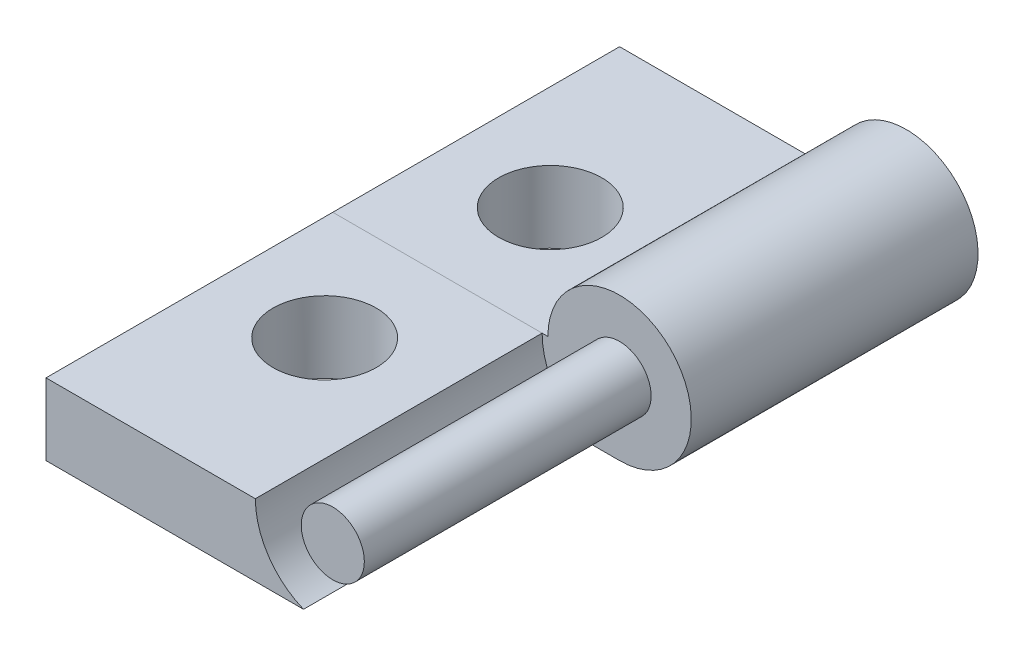
from build123d import *

# Parameters (mm, degrees)
BOSS_EXTRUDE1_DEPTH = 12.7
SKETCH3_R           = 1.397
BOSS_EXTRUDE2_DEPTH = 12.7
SKETCH4_R           = 2.286
CUT_EXTRUDE1_DEPTH  = 12.7


with BuildPart() as part:
    # Sketch1 → Boss-Extrude1 (new body)
    with BuildSketch(Plane.XY):
        with BuildLine():
            Line((0, 0), (12.7, 0))
            ThreePointArc((12.7, 0), (14.94506403, 5.42006403), (9.525, 3.175))
            Line((9.525, 3.175), (0, 3.175))
            Line((0, 3.175), (0, 0))
        make_face()
    extrude(amount=BOSS_EXTRUDE1_DEPTH)

    # Sketch3 → Boss-Extrude2 (add)
    with BuildSketch(Plane.XY.offset(12.7)):
        with BuildLine():
            ThreePointArc((11.404586257, 0), (9.853903302, 1.262311122), (9.270936113, 3.174952294))
            Line((9.270936113, 3.174952294), (0, 3.175))
            Line((0, 3.175), (0, 0))
            Line((0, 0), (11.404586257, 0))
        make_face()
        with Locations((12.699985868, 3.174952294)):
            Circle(SKETCH3_R)
    extrude(amount=BOSS_EXTRUDE2_DEPTH)

    # Sketch4 → Cut-Extrude1 (cut)
    with BuildSketch(Plane(origin=(0, 3.175, 0), x_dir=(1, 0, 0), z_dir=(0, 1, 0))):
        with Locations((4.635468056, -7.704666667)):
            Circle(SKETCH4_R)
        with Locations((4.635468056, -17.695333333)):
            Circle(SKETCH4_R)
    extrude(amount=-CUT_EXTRUDE1_DEPTH, mode=Mode.SUBTRACT)


solid = part.part
